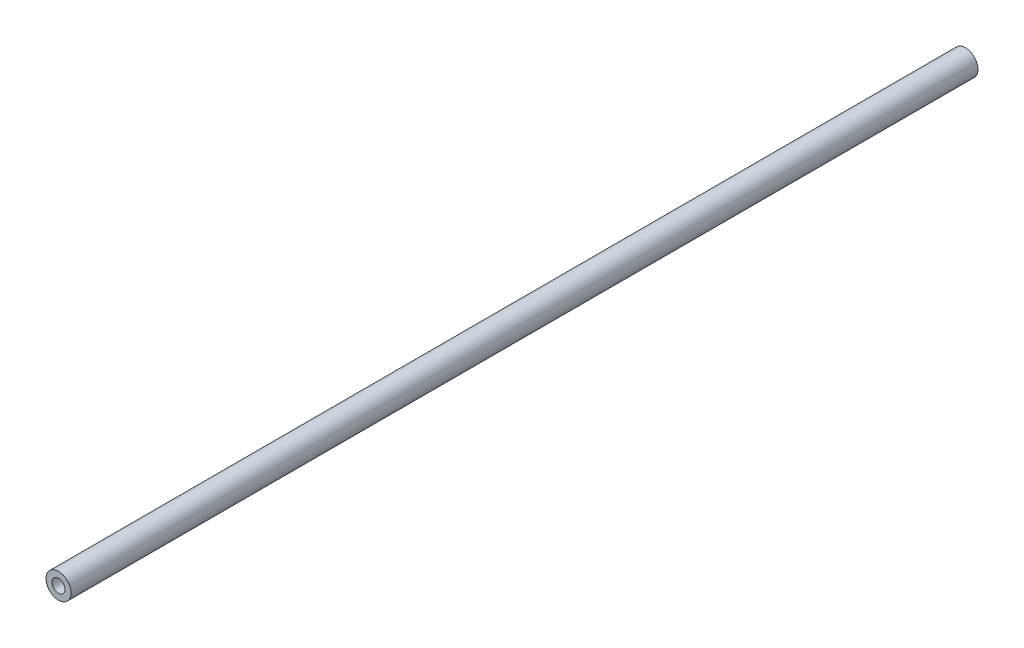
from build123d import *

# Parameters (mm, degrees)
SKETCH1_R                      = 5
BOSS_EXTRUDE1_DEPTH            = 362.5
F_6_0_204_DIAMETER_HOLE1_D     = 5.1816
F_6_0_204_DIAMETER_HOLE1_DEPTH = 30
F_6_0_204_DIAMETER_HOLE1_TIP   = 1.556709692
F_6_0_204_DIAMETER_HOLE2_D     = 5.1816
F_6_0_204_DIAMETER_HOLE2_DEPTH = 30
F_6_0_204_DIAMETER_HOLE2_TIP   = 1.556709692


with BuildPart() as part:
    # Sketch1 → Boss-Extrude1 (new body)
    with BuildSketch(Plane.XY):
        Circle(SKETCH1_R)
    extrude(amount=BOSS_EXTRUDE1_DEPTH)

    # #6 (0.204) Diameter Hole1
    with Locations(Plane(origin=(0, 0, 0), x_dir=(-1, 0, 0), z_dir=(0, 0, -1))):
        with Locations((0, 0)):
            Hole(F_6_0_204_DIAMETER_HOLE1_D / 2, depth=F_6_0_204_DIAMETER_HOLE1_DEPTH)
            with Locations((0, 0, -(F_6_0_204_DIAMETER_HOLE1_DEPTH + F_6_0_204_DIAMETER_HOLE1_TIP / 2))):  # 118° drill point
                Cone(0, F_6_0_204_DIAMETER_HOLE1_D / 2, F_6_0_204_DIAMETER_HOLE1_TIP, mode=Mode.SUBTRACT)

    # #6 (0.204) Diameter Hole2
    with Locations(Plane.XY.offset(362.5)):
        with Locations((0, 0)):
            Hole(F_6_0_204_DIAMETER_HOLE2_D / 2, depth=F_6_0_204_DIAMETER_HOLE2_DEPTH)
            with Locations((0, 0, -(F_6_0_204_DIAMETER_HOLE2_DEPTH + F_6_0_204_DIAMETER_HOLE2_TIP / 2))):  # 118° drill point
                Cone(0, F_6_0_204_DIAMETER_HOLE2_D / 2, F_6_0_204_DIAMETER_HOLE2_TIP, mode=Mode.SUBTRACT)


solid = part.part
